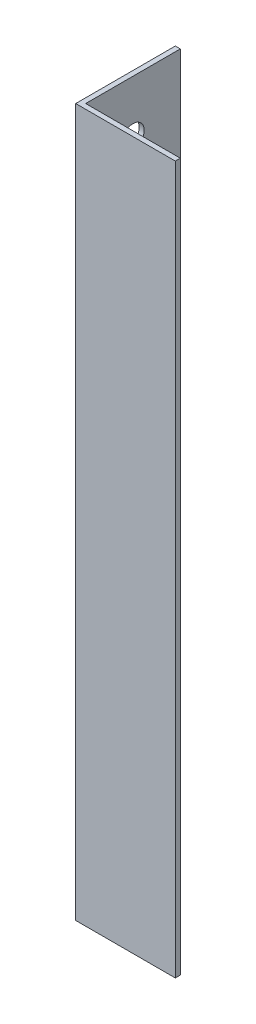
from build123d import *

# Parameters (mm, degrees)
EXTRUDE_1_DEPTH     = 142
SKETCH_2_R          = 2.25
CUT_EXTRUDE_1_DEPTH = 145.654761415
SKETCH_3_R          = 2.25
CUT_EXTRUDE_2_DEPTH = 145.789502382


with BuildPart() as part:
    # Эскиз1 → Бобышка-Вытянуть1 (new body)
    with BuildSketch(Plane(origin=(0, 0, 0), x_dir=(1, 0, 0), z_dir=(0, 1, 0))):
        Polygon((0, 0), (0, 20), (1, 20), (1, 1), (20, 1), (20, 0), align=None)
    extrude(amount=EXTRUDE_1_DEPTH)

    # Эскиз2 → Вырез-Вытянуть1 (cut, through all)
    with BuildSketch(Plane(origin=(1, 0, 0), x_dir=(0, 0, -1), z_dir=(1, 0, 0))):
        with Locations((10.5, 131.5)):
            Circle(SKETCH_2_R)
    extrude(amount=-CUT_EXTRUDE_1_DEPTH, mode=Mode.SUBTRACT)

    # Эскиз3 → Вырез-Вытянуть2 (cut, through all)
    with BuildSketch(Plane.ZY):
        with Locations((-10.5, 30.5)):
            Circle(SKETCH_3_R)
    extrude(amount=-CUT_EXTRUDE_2_DEPTH, mode=Mode.SUBTRACT)


solid = part.part
